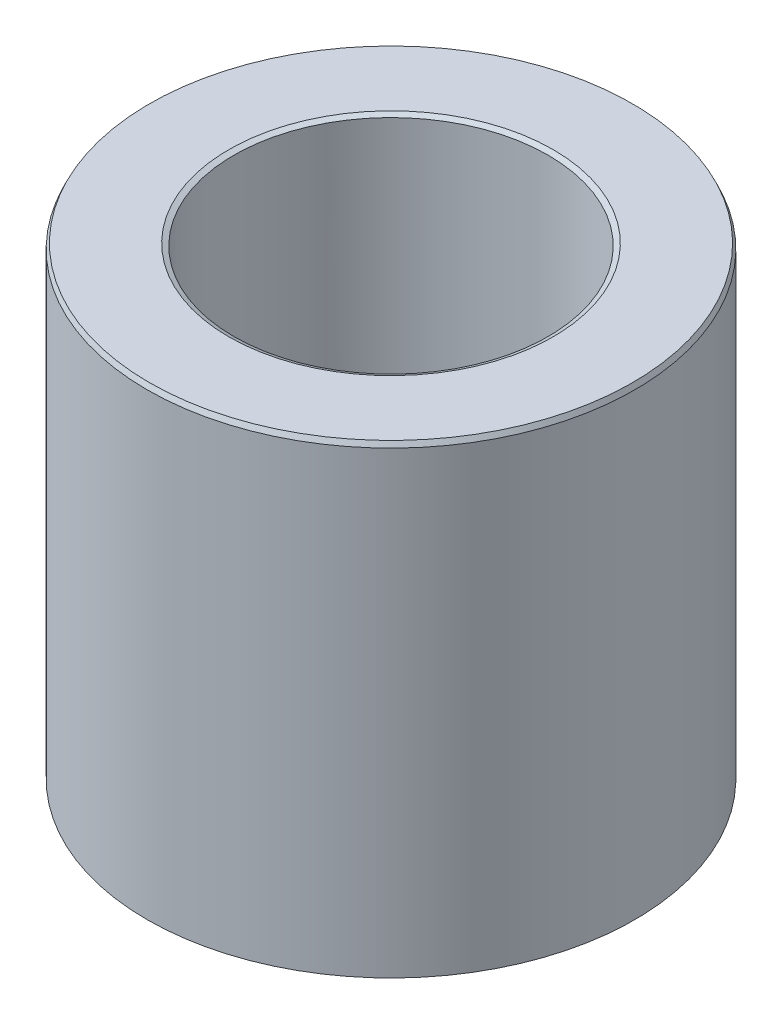
from build123d import *
from OCP.BRepFilletAPI import BRepFilletAPI_MakeChamfer

# Parameters (mm, degrees)
SKETCH1_R           = 37.5
BOSS_EXTRUDE1_DEPTH = 71.702583174
SKETCH2_R           = 24.166277454
CUT_EXTRUDE1_DEPTH  = 90.183857473
CHAMFER1_SIZE       = 0.775573872
CHAMFER1_SIZE2      = 0.352131171


with BuildPart() as part:
    # Sketch1 → Boss-Extrude1 (new body)
    with BuildSketch(Plane(origin=(0, 0, 0), x_dir=(1, 0, 0), z_dir=(0, 1, 0))):
        Circle(SKETCH1_R)
    extrude(amount=BOSS_EXTRUDE1_DEPTH)

    # Sketch2 → Cut-Extrude1 (cut, through all)
    with BuildSketch(Plane(origin=(0, 0, 0), x_dir=(1, 0, 0), z_dir=(0, 1, 0))):
        Circle(SKETCH2_R)
    extrude(amount=CUT_EXTRUDE1_DEPTH, mode=Mode.SUBTRACT)

    # Chamfer1: one chamfer whose edges measure the first distance from different faces: ONE call of the kernel's chamfer builder (chamfer() names one face for all edges)
    chamfer1_edges_1 = [part.edges().sort_by_distance(p)[0] for p in [
        (-24.166277454, 71.702583174, 0),
    ]]
    chamfer1_side_1 = [part.faces().sort_by_distance(p)[0] for p in [
        (-36.439339828, 71.702583174, 0),
    ]]
    chamfer1_edges_2 = [part.edges().sort_by_distance(p)[0] for p in [
        (-24.166277454, 0, 0),
    ]]
    chamfer1_side_2 = [part.faces().sort_by_distance(p)[0] for p in [
        (-24.166277454, 35.851291587, 0),
    ]]
    chamfer1_edges_3 = [part.edges().sort_by_distance(p)[0] for p in [
        (-37.5, 0, 0),
    ]]
    chamfer1_side_3 = [part.faces().sort_by_distance(p)[0] for p in [
        (-36.439339828, 0, 0),
    ]]
    chamfer1_edges_4 = [part.edges().sort_by_distance(p)[0] for p in [
        (-37.5, 71.702583174, 0),
    ]]
    chamfer1_side_4 = [part.faces().sort_by_distance(p)[0] for p in [
        (-37.5, 35.851291587, 0),
    ]]
    chamfer1 = BRepFilletAPI_MakeChamfer(part.part.solid().wrapped)
    for e in chamfer1_edges_1:
        chamfer1.Add(CHAMFER1_SIZE, CHAMFER1_SIZE2, e.wrapped, chamfer1_side_1[0].wrapped)  # the first distance lies on this face
    for e in chamfer1_edges_2:
        chamfer1.Add(CHAMFER1_SIZE, CHAMFER1_SIZE2, e.wrapped, chamfer1_side_2[0].wrapped)  # the first distance lies on this face
    for e in chamfer1_edges_3:
        chamfer1.Add(CHAMFER1_SIZE, CHAMFER1_SIZE2, e.wrapped, chamfer1_side_3[0].wrapped)  # the first distance lies on this face
    for e in chamfer1_edges_4:
        chamfer1.Add(CHAMFER1_SIZE, CHAMFER1_SIZE2, e.wrapped, chamfer1_side_4[0].wrapped)  # the first distance lies on this face
    add(Compound.cast(chamfer1.Shape()), mode=Mode.REPLACE)


solid = part.part
